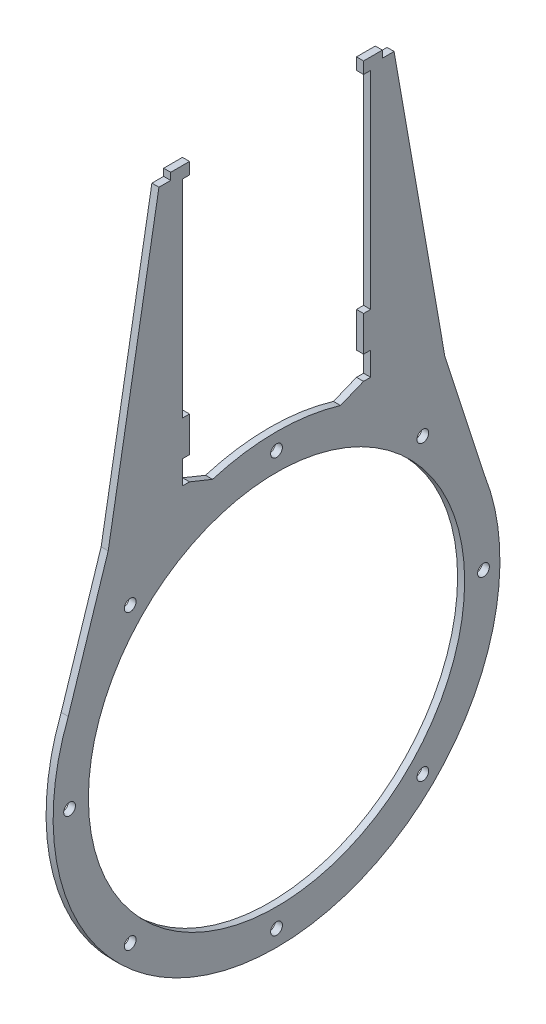
from build123d import *

# Parameters (mm, degrees)
SZKIC1_R                    = 80
SZKIC1_R_2                  = 2.5
DODANIE_WYCI_GNI_CIE1_DEPTH = 3


with BuildPart() as part:
    # Szkic1 → Dodanie-wyciągnięcie1 (new body)
    with BuildSketch(Plane(origin=(0, 0, 0), x_dir=(0, 0, -1), z_dir=(1, 0, 0))):
        with BuildLine():
            Line((37, 213), (45, 213))
            Line((45, 213), (45, 210))
            Line((45, 210), (50, 210))
            Line((50, 210), (71.582358073, 86.870246064))
            Line((71.582358073, 86.870246064), (88.560197953, 34.381555782))
            ThreePointArc((88.560197953, 34.381555782), (0, -95.000000207), (-88.560197953, 34.381555782))
            Line((-88.560197953, 34.381555782), (-71.582358073, 86.870246064))
            Line((-71.582358073, 86.870246064), (-50, 210))
            Line((-50, 210), (-45, 210))
            Line((-45, 210), (-45, 213))
            Line((-45, 213), (-37, 213))
            Line((-37, 213), (-37, 208))
            Line((-37, 208), (-40, 208))
            Line((-40, 208), (-40, 120))
            Line((-40, 120), (-37, 120))
            Line((-37, 120), (-37, 105))
            Line((-37, 105), (-40, 105))
            Line((-40, 105), (-40, 95))
            Line((-40, 95), (-37, 95))
            Line((-37, 95), (-27.19407475, 91.024624899))
            ThreePointArc((-27.19407475, 91.024624899), (0, 95.000000207), (27.19407475, 91.024624899))
            Line((27.19407475, 91.024624899), (37, 95))
            Line((37, 95), (40, 95))
            Line((40, 95), (40, 105))
            Line((40, 105), (37, 105))
            Line((37, 105), (37, 120))
            Line((37, 120), (40, 120))
            Line((40, 120), (40, 208))
            Line((40, 208), (37, 208))
            Line((37, 208), (37, 213))
        make_face()
        Circle(SZKIC1_R, mode=Mode.SUBTRACT)
        with Locations((0, 88)):
            Circle(SZKIC1_R_2, mode=Mode.SUBTRACT)
        with Locations((-62.225396744, 62.225396744)):
            Circle(SZKIC1_R_2, mode=Mode.SUBTRACT)
        with Locations((-88, 0)):
            Circle(SZKIC1_R_2, mode=Mode.SUBTRACT)
        with Locations((-62.225396744, -62.225396744)):
            Circle(SZKIC1_R_2, mode=Mode.SUBTRACT)
        with Locations((0, -88)):
            Circle(SZKIC1_R_2, mode=Mode.SUBTRACT)
        with Locations((62.225396744, -62.225396744)):
            Circle(SZKIC1_R_2, mode=Mode.SUBTRACT)
        with Locations((88, 0)):
            Circle(SZKIC1_R_2, mode=Mode.SUBTRACT)
        with Locations((62.225396744, 62.225396744)):
            Circle(SZKIC1_R_2, mode=Mode.SUBTRACT)
    extrude(amount=DODANIE_WYCI_GNI_CIE1_DEPTH)


solid = part.part
